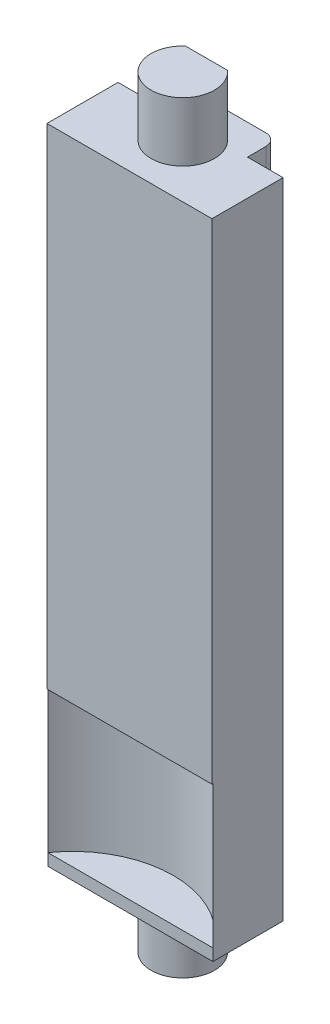
from build123d import *

# Parameters (mm, degrees)
BOSS_EXTRUDE1_DEPTH = 54.32
FILLET1_R           = 1
BOSS_EXTRUDE2_DEPTH = 5
SKETCH3_R           = 8.5
CUT_EXTRUDE1_DEPTH  = 13
BOSS_EXTRUDE3_DEPTH = 1


with BuildPart() as part:
    # Sketch1 → Boss-Extrude1 (new body)
    with BuildSketch(Plane(origin=(0, 0, 0), x_dir=(1, 0, 0), z_dir=(0, 1, 0))):
        Polygon((10.92, -2.55), (7.92, -2.55), (7.92, 0), (0, 0), (0, -2.55), (-3, -2.55), (-3, -8.55), (10.92, -8.55), align=None)
    extrude(amount=BOSS_EXTRUDE1_DEPTH)

    # Fillet1
    fillet1_edges = [part.edges().sort_by_distance(p)[0] for p in [
        (7.92, 27.16, 0),
        (0, 27.16, 0),
    ]]
    fillet(fillet1_edges, radius=FILLET1_R)

    # Sketch2 → Boss-Extrude2 (add)
    with BuildSketch(Plane(origin=(0, 54.32, 0), x_dir=(1, 0, 0), z_dir=(0, 1, 0))):
        with BuildLine():
            Line((5.736407892, -2.05), (2.183592108, -2.05))
            ThreePointArc((2.183592108, -2.05), (2.863703077, -6.490032388), (6.635, -4.05))
            ThreePointArc((6.635, -4.05), (6.400032388, -2.953703077), (5.736407892, -2.05))
        make_face()
    boss_extrude2 = extrude(amount=BOSS_EXTRUDE2_DEPTH)

    # Mirror1: Boss-Extrude2 across plane
    add(boss_extrude2.mirror(Plane.ZX.offset(27.16)))

    # Sketch3 → Cut-Extrude1 (cut)
    with BuildSketch(Plane.XZ):
        with Locations((3.96, 13.348484692)):
            Circle(SKETCH3_R)
    extrude(amount=-CUT_EXTRUDE1_DEPTH, mode=Mode.SUBTRACT)

    # Sketch4 → Boss-Extrude3 (add)
    with BuildSketch(Plane(origin=(0, 0, 0), x_dir=(1, 0, 0), z_dir=(0, 1, 0))):
        with BuildLine():
            Line((-3, -8.469099485), (10.92, -8.469099485))
            ThreePointArc((10.92, -8.469099485), (8.9248008, -6.449154796), (6.375674383, -5.198974445))
            ThreePointArc((6.375674383, -5.198974445), (3.96, -4.848484692), (1.544325617, -5.198974445))
            ThreePointArc((1.544325617, -5.198974445), (-1.0048008, -6.449154796), (-3, -8.469099485))
        make_face()
    extrude(amount=BOSS_EXTRUDE3_DEPTH)


solid = part.part
